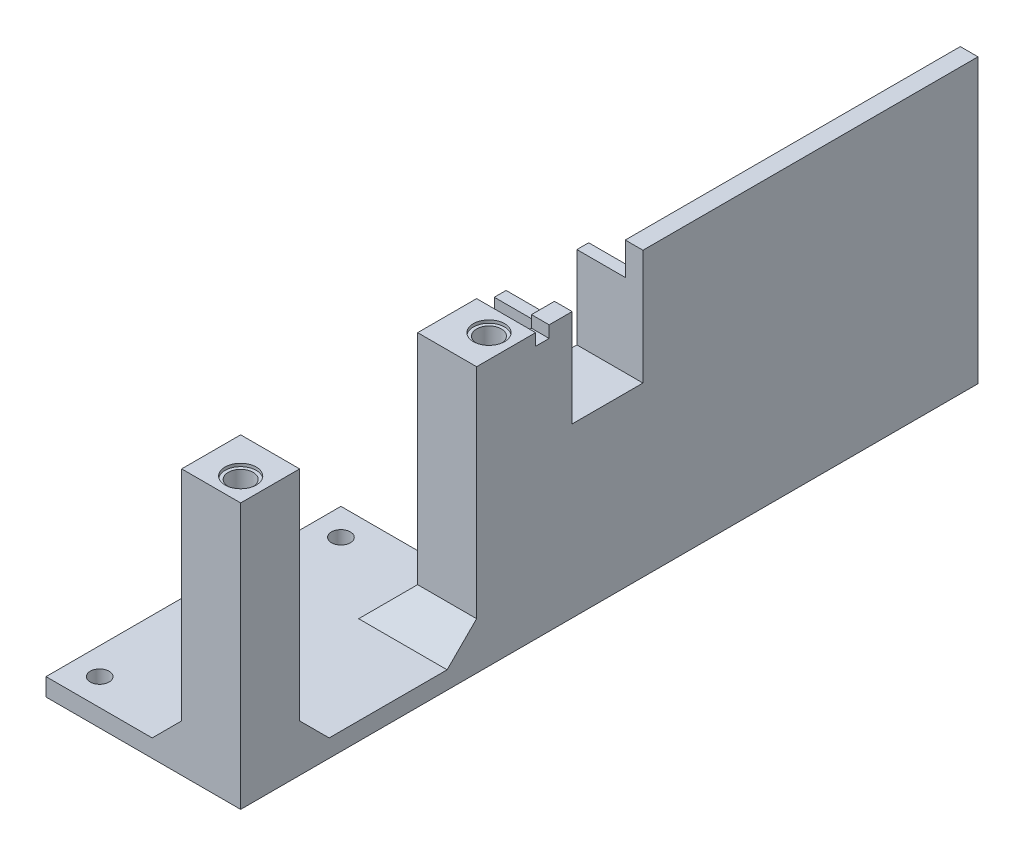
from build123d import *

# Parameters (mm, degrees)
SKETCH1_R           = 1.6
BOSS_EXTRUDE1_DEPTH = 3
SKETCH2_W           = 10
SKETCH2_H           = 10
BOSS_EXTRUDE2_DEPTH = 42
CHAMFER1_SIZE       = 5
SKETCH3_R           = 2.1
CUT_EXTRUDE1_DEPTH  = 52
SKETCH4_R           = 2.65
CUT_EXTRUDE2_DEPTH  = 0.5
SKETCH5_W           = 3
SKETCH5_H           = 43
BOSS_EXTRUDE3_DEPTH = 75
SKETCH6_W           = 3
SKETCH6_H           = 72.7
BOSS_EXTRUDE4_DEPTH = 2
SKETCH7_W           = 3
SKETCH7_H           = 68.8
BOSS_EXTRUDE5_DEPTH = 3
SKETCH8_R           = 1
BOSS_EXTRUDE7_DEPTH = 8.2
SKETCH9_W           = 12
SKETCH9_H           = 19.5
CUT_EXTRUDE3_DEPTH  = 8.5


with BuildPart() as part:
    # Sketch1 → Boss-Extrude1 (new body)
    with BuildSketch(Plane(origin=(0, 0, 0), x_dir=(1, 0, 0), z_dir=(0, 1, 0))):
        Polygon((-6.512396694, 9.685950413), (1.487603306, 9.685950413), (26.487603306, 9.685950413), (26.487603306, -40.314049587), (1.487603306, -40.314049587), (-6.512396694, -40.314049587), align=None)
        with Locations((-1.962396694, -35.764049587)):
            Circle(SKETCH1_R, mode=Mode.SUBTRACT)
        with Locations((-1.962396694, 5.135950413)):
            Circle(SKETCH1_R, mode=Mode.SUBTRACT)
    extrude(amount=BOSS_EXTRUDE1_DEPTH)

    # Sketch2 → Boss-Extrude2 (add)
    with BuildSketch(Plane(origin=(0, 3, 0), x_dir=(1, 0, 0), z_dir=(0, 1, 0))):
        with Locations((21.487603306, -35.314049587)):
            Rectangle(SKETCH2_W, SKETCH2_H)
        with Locations((21.487603306, 4.685950413)):
            Rectangle(SKETCH2_W, SKETCH2_H)
    extrude(amount=BOSS_EXTRUDE2_DEPTH)

    # Chamfer1
    chamfer1_edges = [part.edges().sort_by_distance(p)[0] for p in [
        (16.487603306, 3, -4.685950413),
        (21.487603306, 3, 0.314049587),
        (16.487603306, 3, 35.314049587),
        (21.487603306, 3, 30.314049587),
    ]]
    chamfer(chamfer1_edges, length=CHAMFER1_SIZE)

    # Sketch3 → Cut-Extrude1 (cut)
    with BuildSketch(Plane(origin=(0, 45, 0), x_dir=(1, 0, 0), z_dir=(0, 1, 0))):
        with Locations((22.537603306, -36.364049587)):
            Circle(SKETCH3_R)
        with Locations((22.537603306, 5.735950413)):
            Circle(SKETCH3_R)
    extrude(amount=-CUT_EXTRUDE1_DEPTH, mode=Mode.SUBTRACT)

    # Sketch4 → Cut-Extrude2 (cut)
    with BuildSketch(Plane(origin=(0, 45, 0), x_dir=(1, 0, 0), z_dir=(0, 1, 0))):
        with Locations((22.537603306, -36.364049587)):
            Circle(SKETCH4_R)
        with Locations((22.537603306, 5.735950413)):
            Circle(SKETCH4_R)
    cut_extrude2 = extrude(amount=-CUT_EXTRUDE2_DEPTH, mode=Mode.SUBTRACT)

    # Mirror1: Cut-Extrude2 across plane
    add(cut_extrude2.mirror(Plane(origin=(0, 22.5, 0), x_dir=(0, 0, 1), z_dir=(0, -1, 0))), mode=Mode.SUBTRACT)

    # Sketch5 → Boss-Extrude3 (add)
    with BuildSketch(Plane(origin=(0, 0, -9.685950413), x_dir=(-1, 0, 0), z_dir=(0, 0, -1))):
        with Locations((-24.987603306, 21.5)):
            Rectangle(SKETCH5_W, SKETCH5_H)
    extrude(amount=BOSS_EXTRUDE3_DEPTH)

    # Sketch6 → Boss-Extrude4 (add)
    with BuildSketch(Plane(origin=(0, 43, 0), x_dir=(1, 0, 0), z_dir=(0, 1, 0))):
        with Locations((24.987603306, 48.335950413)):
            Rectangle(SKETCH6_W, SKETCH6_H)
    extrude(amount=BOSS_EXTRUDE4_DEPTH)

    # Sketch7 → Boss-Extrude5 (add)
    with BuildSketch(Plane(origin=(0, 45, 0), x_dir=(1, 0, 0), z_dir=(0, 1, 0))):
        with Locations((24.987603306, 50.285950413)):
            Rectangle(SKETCH7_W, SKETCH7_H)
    extrude(amount=BOSS_EXTRUDE5_DEPTH)

    # Sketch8 → Boss-Extrude7 (add)
    with BuildSketch(Plane.ZY.offset(-23.487603306)):
        Polygon((-15.885950413, 28.5), (-27.885950413, 28.5), (-27.885950413, 42.5), (-29.885950413, 42.5), (-29.885950413, 22.5), (-13.885950413, 22.5), (-13.885950413, 42.5), (-15.885950413, 42.5), align=None)
        with Locations((-21.885950413, 24.5)):
            Circle(SKETCH8_R, mode=Mode.SUBTRACT)
    extrude(amount=BOSS_EXTRUDE7_DEPTH)

    # Sketch9 → Cut-Extrude3 (cut)
    with BuildSketch(Plane.ZY.offset(-23.487603306)):
        with Locations((-21.885950413, 38.25)):
            Rectangle(SKETCH9_W, SKETCH9_H)
    extrude(amount=-CUT_EXTRUDE3_DEPTH, mode=Mode.SUBTRACT)


solid = part.part
